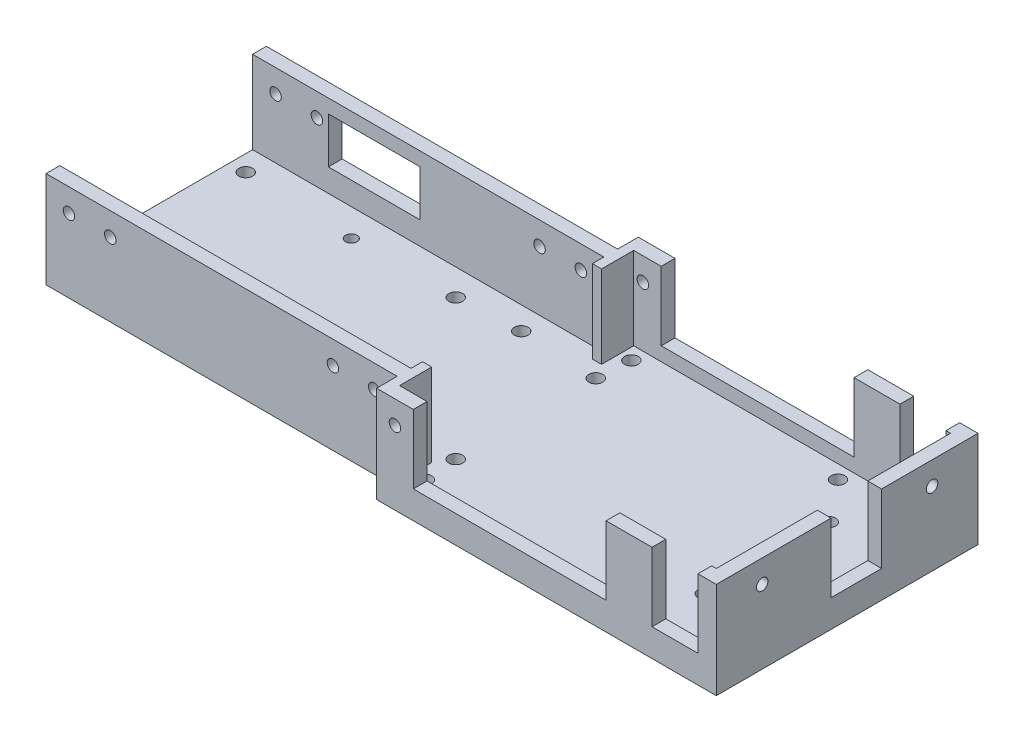
from build123d import *

# Parameters (mm, degrees)
SKETCH1_W           = 150.5
SKETCH1_H           = 48
BOSS_EXTRUDE1_DEPTH = 3
SKETCH2_R           = 1.5
SKETCH2_R_2         = 1.25
CUT_EXTRUDE1_DEPTH  = 119.078192337
SKETCH4_W           = 74
SKETCH4_H           = 4.5
BOSS_EXTRUDE2_DEPTH = 3
SKETCH5_R           = 1.5
CUT_EXTRUDE3_DEPTH  = 120.153370639
SKETCH6_W           = 10
SKETCH6_H           = 3
BOSS_EXTRUDE3_DEPTH = 18
SKETCH8_W           = 10
SKETCH8_H           = 3
SKETCH8_W_2         = 42
SKETCH8_W_3         = 3
SKETCH8_H_2         = 11
BOSS_EXTRUDE4_DEPTH = 3
CUT_EXTRUDE4_REACH  = 130.257
SKETCH9_W           = 20
SKETCH9_H           = 10
CUT_EXTRUDE5_REACH  = 157.007
SKETCH10_R          = 1.25
SKETCH11_R          = 1.25
CUT_EXTRUDE6_DEPTH  = 129.257496038
SKETCH12_R          = 1.25
CUT_EXTRUDE7_DEPTH  = 131.164262722


with BuildPart() as part:
    # Sketch1 → Boss-Extrude1 (new body)
    with BuildSketch(Plane(origin=(0, 0, 0), x_dir=(1, 0, 0), z_dir=(0, 1, 0))):
        with Locations((-39.87052506, -2.090692124)):
            Rectangle(SKETCH1_W, SKETCH1_H)
    extrude(amount=BOSS_EXTRUDE1_DEPTH)

    # Sketch2 → Cut-Extrude1 (cut, through all)
    with BuildSketch(Plane(origin=(0, 3, 0), x_dir=(1, 0, 0), z_dir=(0, 1, 0))):
        with Locations((-65.12052506, 13.159307876)):
            Circle(SKETCH2_R)
        with Locations((-65.12052506, -17.340692124)):
            Circle(SKETCH2_R)
        with Locations((-34.62052506, -17.340692124)):
            Circle(SKETCH2_R)
        with Locations((-34.62052506, 13.159307876)):
            Circle(SKETCH2_R)
        with Locations((17.87947494, -15.590692124)):
            Circle(SKETCH2_R)
        with Locations((17.87947494, 11.409307876)):
            Circle(SKETCH2_R)
        with Locations((-111.62052506, -18.090692124)):
            Circle(SKETCH2_R)
        with Locations((-111.62052506, 13.909307876)):
            Circle(SKETCH2_R)
        with Locations((-87.62052506, 12.909307876)):
            Circle(SKETCH2_R_2)
        with Locations((-87.62052506, -17.090692124)):
            Circle(SKETCH2_R_2)
        with Locations((-51.62052506, 13.909307876)):
            Circle(SKETCH2_R)
        with Locations((-51.62052506, -18.090692124)):
            Circle(SKETCH2_R)
    extrude(amount=-CUT_EXTRUDE1_DEPTH, mode=Mode.SUBTRACT)

    # Sketch4 → Boss-Extrude2 (add)
    with BuildSketch(Plane(origin=(0, 3, 0), x_dir=(1, 0, 0), z_dir=(0, 1, 0))):
        with Locations((-1.62052506, 24.159307876)):
            Rectangle(SKETCH4_W, SKETCH4_H)
        with Locations((-1.62052506, -28.340692124)):
            Rectangle(SKETCH4_W, SKETCH4_H)
    extrude(amount=-BOSS_EXTRUDE2_DEPTH)

    # Sketch5 → Cut-Extrude3 (cut, through all)
    with BuildSketch(Plane(origin=(0, 3, 0), x_dir=(1, 0, 0), z_dir=(0, 1, 0))):
        with Locations((-34.12052506, 20.409307876)):
            Circle(SKETCH5_R)
        with Locations((-34.12052506, -24.590692124)):
            Circle(SKETCH5_R)
        with Locations((10.87947494, 20.409307876)):
            Circle(SKETCH5_R)
        with Locations((10.87947494, -24.590692124)):
            Circle(SKETCH5_R)
    extrude(amount=-CUT_EXTRUDE3_DEPTH, mode=Mode.SUBTRACT)

    # Sketch6 → Boss-Extrude3 (add)
    with BuildSketch(Plane(origin=(0, 3, 0), x_dir=(1, 0, 0), z_dir=(0, 1, 0))):
        Polygon((35.37947494, -5.590692124), (32.37947494, -5.590692124), (32.37947494, -27.590692124), (31.37947494, -27.590692124), (31.37947494, -30.590692124), (35.37947494, -30.590692124), align=None)
        Polygon((35.37947494, 26.409307876), (31.37947494, 26.409307876), (31.37947494, 23.409307876), (32.37947494, 23.409307876), (32.37947494, 5.409307876), (35.37947494, 5.409307876), align=None)
        Polygon((-30.62052506, 23.409307876), (-30.62052506, 26.409307876), (-38.62052506, 26.409307876), (-38.62052506, 21.909307876), (-115.12052506, 21.909307876), (-115.12052506, 18.909307876), (-38.62052506, 18.909307876), (-38.62052506, 16.409307876), (-36.62052506, 16.409307876), (-36.62052506, 23.409307876), align=None)
        with Locations((16.37947494, 24.909307876)):
            Rectangle(SKETCH6_W, SKETCH6_H)
        Polygon((-36.62052506, -20.590692124), (-38.62052506, -20.590692124), (-38.62052506, -23.090692124), (-115.12052506, -23.090692124), (-115.12052506, -26.090692124), (-38.62052506, -26.090692124), (-38.62052506, -30.590692124), (-30.62052506, -30.590692124), (-30.62052506, -27.590692124), (-36.62052506, -27.590692124), align=None)
        with Locations((16.37947494, -29.090692124)):
            Rectangle(SKETCH6_W, SKETCH6_H)
    extrude(amount=BOSS_EXTRUDE3_DEPTH)

    # Sketch8 → Boss-Extrude4 (add)
    with BuildSketch(Plane(origin=(0, 3, 0), x_dir=(1, 0, 0), z_dir=(0, 1, 0))):
        with Locations((26.37947494, -29.090692124)):
            Rectangle(SKETCH8_W, SKETCH8_H)
        with Locations((26.37947494, 24.909307876)):
            Rectangle(SKETCH8_W, SKETCH8_H)
        with Locations((-9.62052506, 24.909307876)):
            Rectangle(SKETCH8_W_2, SKETCH8_H)
        with Locations((-9.62052506, -29.090692124)):
            Rectangle(SKETCH8_W_2, SKETCH8_H)
        with Locations((33.87947494, -0.090692124)):
            Rectangle(SKETCH8_W_3, SKETCH8_H_2)
    extrude(amount=BOSS_EXTRUDE4_DEPTH)

    # Sketch9 → Cut-Extrude4 (cut, up to next)
    with BuildSketch(Plane(origin=(0, 0, -21.909307876), x_dir=(-1, 0, 0), z_dir=(0, 0, -1)), mode=Mode.PRIVATE) as cut_extrude4_sk1:
        with Locations((88.62052506, 13)):
            Rectangle(SKETCH9_W, SKETCH9_H)
    cut_extrude4_tool1 = extrude(cut_extrude4_sk1.sketch, amount=-CUT_EXTRUDE4_REACH, mode=Mode.PRIVATE) & part.part
    add(cut_extrude4_tool1.solids().sort_by_distance((-88.620525, 13, -21.909308))[0], mode=Mode.SUBTRACT)

    # Sketch10 → Cut-Extrude5 (cut, up to next)
    with BuildSketch(Plane(origin=(35.37947494, 0, 0), x_dir=(0, 0, -1), z_dir=(1, 0, 0)), mode=Mode.PRIVATE) as cut_extrude5_sk1:
        with Locations((-20.590692124, 16)):
            Circle(SKETCH10_R)
    cut_extrude5_tool1 = extrude(cut_extrude5_sk1.sketch, amount=-CUT_EXTRUDE5_REACH, mode=Mode.PRIVATE) & part.part
    # Sketch10 → Cut-Extrude5 (cut, up to next)
    with BuildSketch(Plane(origin=(35.37947494, 0, 0), x_dir=(0, 0, -1), z_dir=(1, 0, 0)), mode=Mode.PRIVATE) as cut_extrude5_sk2:
        with Locations((16.409307876, 16)):
            Circle(SKETCH10_R)
    cut_extrude5_tool2 = extrude(cut_extrude5_sk2.sketch, amount=-CUT_EXTRUDE5_REACH, mode=Mode.PRIVATE) & part.part
    add(cut_extrude5_tool1.solids().sort_by_distance((35.379475, 16, 20.590692))[0], mode=Mode.SUBTRACT)
    add(cut_extrude5_tool2.solids().sort_by_distance((35.379475, 16, -16.409308))[0], mode=Mode.SUBTRACT)

    # Sketch11 → Cut-Extrude6 (cut, through all)
    with BuildSketch(Plane(origin=(0, 0, -21.909307876), x_dir=(-1, 0, 0), z_dir=(0, 0, -1))):
        with Locations((43.62052506, 16)):
            Circle(SKETCH11_R)
        with Locations((110.12052506, 16)):
            Circle(SKETCH11_R)
        with Locations((52.62052506, 16)):
            Circle(SKETCH11_R)
        with Locations((101.12052506, 16)):
            Circle(SKETCH11_R)
    extrude(amount=-CUT_EXTRUDE6_DEPTH, mode=Mode.SUBTRACT)

    # Sketch12 → Cut-Extrude7 (cut, through all)
    with BuildSketch(Plane(origin=(0, 0, -26.409307876), x_dir=(-1, 0, 0), z_dir=(0, 0, -1))):
        with Locations((34.62052506, 16)):
            Circle(SKETCH12_R)
    extrude(amount=-CUT_EXTRUDE7_DEPTH, mode=Mode.SUBTRACT)


solid = part.part
